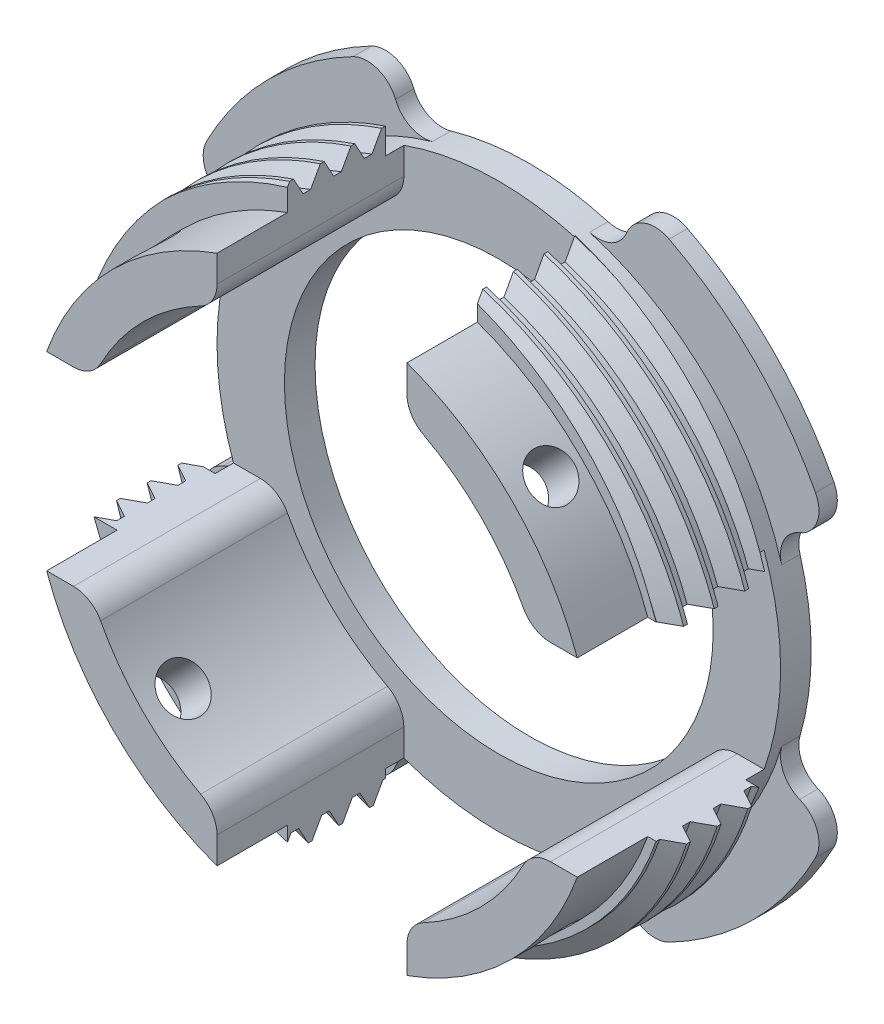
from build123d import *
from build123d.topology import SkipClean

# Parameters (mm, degrees)
SKETCH1_R                = 4.6
SKETCH1_R_2              = 3.9
BOSS_EXTRUDE1_DEPTH      = 0.5
BOSS_EXTRUDE2_DEPTH      = 3.05
FILLET_START             = 0.5
FILLET_1_DEPTH           = 3.05
EXTRUDE_1_DEPTH          = 2.4
THREAD_1_PITCH           = 0.5
PATTERN_CIRCULAR_1_COUNT = 4
SKETCH_9_R               = 3.9
SKETCH_9_R_2             = 3.5
EXTRUDE_2_DEPTH          = 0.5
SKETCH_11_OUTSIDE_W      = 14.29
SKETCH_11_OUTSIDE_H      = 14.29
SKETCH_11_OUTSIDE_R      = 4.6
CUT_EXTRUDE_1_DEPTH      = 0.8
EXTRUDE_4_DEPTH          = 0.3
FILLET_3_R               = 0.5
FILLET_4_DEPTH           = 0.3


with BuildPart() as part:
    # Sketch1 → Boss-Extrude1 (new body)
    with BuildSketch(Plane.XY):
        Circle(SKETCH1_R)
        Circle(SKETCH1_R_2, mode=Mode.SUBTRACT)
    extrude(amount=BOSS_EXTRUDE1_DEPTH)

    # Sketch2 → Boss-Extrude2 (add)
    with SkipClean():  # the faces are left unmerged after this step: merging them gives an invalid solid
        with BuildSketch(Plane.XY.offset(0.5)):
            with BuildLine():
                Line((4.330992958, 1.55), (3.578756767, 1.55))
                ThreePointArc((3.578756767, 1.55), (2.757716447, 2.757716447), (1.55, 3.578756767))
                Line((1.55, 3.578756767), (1.55, 4.330992958))
                ThreePointArc((1.55, 4.330992958), (3.252691193, 3.252691193), (4.330992958, 1.55))
            make_face()
            with BuildLine():
                Line((-4.330992958, 1.55), (-3.578756767, 1.55))
                ThreePointArc((-3.578756767, 1.55), (-2.757716447, 2.757716447), (-1.55, 3.578756767))
                Line((-1.55, 3.578756767), (-1.55, 4.330992958))
                ThreePointArc((-1.55, 4.330992958), (-3.252691193, 3.252691193), (-4.330992958, 1.55))
            make_face()
            with BuildLine():
                Line((1.55, -4.330992958), (1.55, -3.578756767))
                ThreePointArc((1.55, -3.578756767), (2.757716447, -2.757716447), (3.578756767, -1.55))
                Line((3.578756767, -1.55), (4.330992958, -1.55))
                ThreePointArc((4.330992958, -1.55), (3.252691193, -3.252691193), (1.55, -4.330992958))
            make_face()
            with BuildLine():
                Line((-4.330992958, -1.55), (-3.578756767, -1.55))
                ThreePointArc((-3.578756767, -1.55), (-2.757716447, -2.757716447), (-1.55, -3.578756767))
                Line((-1.55, -3.578756767), (-1.55, -4.330992958))
                ThreePointArc((-1.55, -4.330992958), (-3.252691193, -3.252691193), (-4.330992958, -1.55))
            make_face()
        extrude(amount=BOSS_EXTRUDE2_DEPTH)

    # 草图5 → M1x0.25 螺纹孔1 (revolve, cut)
    with SkipClean():  # the faces are left unmerged after this step: merging them gives an invalid solid
        with BuildSketch(Plane(origin=(3.252691193, 3.252691193, 2.9), x_dir=(-0.7071067811865452, 0.7071067811865499, 0), z_dir=(0, 0, 1))):
            Polygon((0, 0), (0, 3.475322732), (0.375, 3.25), (0.375, 0), align=None)
        m1x0_25_1 = revolve(axis=Axis((7.742819254, 7.742819254, 2.9), (-0.7071067811865499, -0.7071067811865452, 0)), mode=Mode.SUBTRACT)

    # 圆角1: read off the stored shape, not the designer's step
    # 圆角1 outline → 圆角1 (cut)
    with SkipClean():  # the faces are left unmerged after this step: merging them gives an invalid solid
        with BuildSketch(Plane.XY.offset(FILLET_START)):
            with BuildLine():
                Line((3.578756767, 1.55), (3.893263413, 1.55))
                ThreePointArc((3.893263413, 1.55), (3.634881208, 1.621936177), (3.450847116, 1.817045455))
                ThreePointArc((3.450847116, 1.817045455), (3.517337204, 1.68473707), (3.578756767, 1.55))
            make_face()
            with BuildLine():
                ThreePointArc((1.55, 3.578756767), (1.68473707, 3.517337204), (1.817045455, 3.450847116))
                ThreePointArc((1.817045455, 3.450847116), (1.621936177, 3.634881208), (1.55, 3.893263413))
                Line((1.55, 3.893263413), (1.55, 3.578756767))
            make_face()
            with BuildLine():
                Line((3.893263413, -1.55), (3.578756767, -1.55))
                ThreePointArc((3.578756767, -1.55), (3.517337204, -1.68473707), (3.450847116, -1.817045455))
                ThreePointArc((3.450847116, -1.817045455), (3.634881208, -1.621936177), (3.893263413, -1.55))
            make_face()
            with BuildLine():
                ThreePointArc((-1.817045455, 3.450847116), (-1.68473707, 3.517337204), (-1.55, 3.578756767))
                Line((-1.55, 3.578756767), (-1.55, 3.893263413))
                ThreePointArc((-1.55, 3.893263413), (-1.621936177, 3.634881208), (-1.817045455, 3.450847116))
            make_face()
            with BuildLine():
                Line((1.55, -3.578756767), (1.55, -3.893263413))
                ThreePointArc((1.55, -3.893263413), (1.621936177, -3.634881208), (1.817045455, -3.450847116))
                ThreePointArc((1.817045455, -3.450847116), (1.68473707, -3.517337204), (1.55, -3.578756767))
            make_face()
            with BuildLine():
                ThreePointArc((-3.450847116, 1.817045455), (-3.634881208, 1.621936177), (-3.893263413, 1.55))
                Line((-3.893263413, 1.55), (-3.578756767, 1.55))
                ThreePointArc((-3.578756767, 1.55), (-3.517337204, 1.68473707), (-3.450847116, 1.817045455))
            make_face()
            with BuildLine():
                ThreePointArc((-1.817045455, -3.450847116), (-1.621936177, -3.634881208), (-1.55, -3.893263413))
                Line((-1.55, -3.893263413), (-1.55, -3.578756767))
                ThreePointArc((-1.55, -3.578756767), (-1.68473707, -3.517337204), (-1.817045455, -3.450847116))
            make_face()
            with BuildLine():
                Line((-3.578756767, -1.55), (-3.893263413, -1.55))
                ThreePointArc((-3.893263413, -1.55), (-3.634881208, -1.621936177), (-3.450847116, -1.817045455))
                ThreePointArc((-3.450847116, -1.817045455), (-3.517337204, -1.68473707), (-3.578756767, -1.55))
            make_face()
        extrude(amount=FILLET_1_DEPTH, mode=Mode.SUBTRACT)

    # Sketch 1 → 凸台-拉伸1 (add)
    with BuildSketch(Plane.XY):
        with BuildLine():
            Line((-1.55, -4.010922587), (-1.55, -4.753682783))
            ThreePointArc((-1.55, -4.753682783), (-3.535533906, -3.535533906), (-4.753682783, -1.55))
            Line((-4.753682783, -1.55), (-4.010922587, -1.55))
            ThreePointArc((-4.010922587, -1.55), (-3.040559159, -3.040559159), (-1.55, -4.010922587))
        make_face()
        with BuildLine():
            Line((1.55, -4.010922587), (1.55, -4.753682783))
            ThreePointArc((1.55, -4.753682783), (3.535533906, -3.535533906), (4.753682783, -1.55))
            Line((4.753682783, -1.55), (4.010922587, -1.55))
            ThreePointArc((4.010922587, -1.55), (3.040559159, -3.040559159), (1.55, -4.010922587))
        make_face()
        with BuildLine():
            Line((-4.010922587, 1.55), (-4.753682783, 1.55))
            ThreePointArc((-4.753682783, 1.55), (-3.535533906, 3.535533906), (-1.55, 4.753682783))
            Line((-1.55, 4.753682783), (-1.55, 4.010922587))
            ThreePointArc((-1.55, 4.010922587), (-3.040559159, 3.040559159), (-4.010922587, 1.55))
        make_face()
        with BuildLine():
            Line((1.55, 4.010922587), (1.55, 4.753682783))
            ThreePointArc((1.55, 4.753682783), (3.535533906, 3.535533906), (4.753682783, 1.55))
            Line((4.753682783, 1.55), (4.010922587, 1.55))
            ThreePointArc((4.010922587, 1.55), (3.040559159, 3.040559159), (1.55, 4.010922587))
        make_face()
    extrude(amount=EXTRUDE_1_DEPTH)

    # 螺纹线1: arcs per turn and ends read off the stored shape
    # 螺纹线1: the profile of Sketch 1 2 profile screwed along a right-hand helix through 6.8 turns, 6 arcs to a turn; built about Z, then put on its axis
    thread_1_z = Axis((0, 0, 0), (0, 0, 1))
    thread_1_corners = [(5.0003, 0, -0.000173205), (5.0003, 0, 0.437673204), (4.729367062, 0, 0.281249999), (4.729367062, 0, 0.156249999)]
    with BuildLine(mode=Mode.PRIVATE) as thread_1_profile:
        Line(thread_1_corners[0], thread_1_corners[1])
        Line(thread_1_corners[1], thread_1_corners[2])
        Line(thread_1_corners[2], thread_1_corners[3])
        Line(thread_1_corners[3], thread_1_corners[0])
    thread_1_cap = Face(thread_1_profile.wire())
    thread_1_turn_angles = [0, 30, 60, 90, 120, 150, 180, 210, 240, 270, 300, 330, 360]
    thread_1_turn_weights = [1, 0.8660254037844387, 1, 0.8660254037844387, 1, 0.8660254037844387, 1, 0.8660254037844387, 1, 0.8660254037844387, 1, 0.8660254037844387, 1]
    thread_1_turn_rails = [Edge.make_bspline([Vector(p[0], p[1], 0).rotate(thread_1_z, thread_1_turn_angles[k]) / thread_1_turn_weights[k] + Vector(0, 0, p[2] + THREAD_1_PITCH * thread_1_turn_angles[k] / 360) for k in range(13)], [0, 0, 0, 1, 1, 2, 2, 3, 3, 4, 4, 5, 5, 6, 6, 6], 2, thread_1_turn_weights) for p in thread_1_corners]
    thread_1_turn_sides = [Face.make_surface_from_curves(thread_1_turn_rails[p[0]], thread_1_turn_rails[p[1]]) for p in [(0, 1), (1, 2), (2, 3), (3, 0)]]
    thread_1_last_angles = [2160, 2190, 2220, 2250, 2280, 2310, 2340, 2370, 2400, 2424, 2448]
    thread_1_last_weights = [1, 0.8660254037844387, 1, 0.8660254037844387, 1, 0.8660254037844387, 1, 0.8660254037844387, 1, 0.9135454576426009, 1]
    thread_1_last_rails = [Edge.make_bspline([Vector(p[0], p[1], 0).rotate(thread_1_z, thread_1_last_angles[k]) / thread_1_last_weights[k] + Vector(0, 0, p[2] + THREAD_1_PITCH * thread_1_last_angles[k] / 360) for k in range(11)], [0, 0, 0, 1, 1, 2, 2, 3, 3, 4, 4, 5, 5, 5], 2, thread_1_last_weights) for p in thread_1_corners]
    thread_1_last_sides = [Face.make_surface_from_curves(thread_1_last_rails[p[0]], thread_1_last_rails[p[1]]) for p in [(0, 1), (1, 2), (2, 3), (3, 0)]]
    thread_1 = Plane(origin=(0, 0, 3.4), x_dir=(-1, 0, 0), z_dir=(0, 0, -1)) * Solid(Shell([*[p.moved(Location((0, 0, THREAD_1_PITCH * i))) for i in range(6) for p in thread_1_turn_sides], *thread_1_last_sides, thread_1_cap, thread_1_cap.rotate(thread_1_z, 2448).moved(Location((0, 0, THREAD_1_PITCH * 2448 / 360)))]))
    add(thread_1, mode=Mode.SUBTRACT)

    # 阵列(圆周)1: M1x0.25 螺纹孔1 ×4 about axis
    pattern_circular_1_axis = Axis((0, 0, 0), (0, 0, 1))
    for i in range(1, PATTERN_CIRCULAR_1_COUNT):
        add(m1x0_25_1.rotate(pattern_circular_1_axis, i * 360 / PATTERN_CIRCULAR_1_COUNT), mode=Mode.SUBTRACT)

    # 草图9 → 凸台-拉伸2 (add)
    with BuildSketch(Plane(origin=(0, 0, 0), x_dir=(-1, 0, 0), z_dir=(0, 0, -1))):
        Circle(SKETCH_9_R)
        Circle(SKETCH_9_R_2, mode=Mode.SUBTRACT)
    extrude(amount=-EXTRUDE_2_DEPTH)

    # 草图11 outside → 切除-拉伸1 (cut)
    with SkipClean():  # the faces are left unmerged after this step: merging them gives an invalid solid
        with BuildSketch(Plane(origin=(0, 0, 0), x_dir=(-1, 0, 0), z_dir=(0, 0, -1))):
            Rectangle(SKETCH_11_OUTSIDE_W, SKETCH_11_OUTSIDE_H)
            with Locations(Location((0, 0, 0), (0, 0, 340.30844298))):
                Circle(SKETCH_11_OUTSIDE_R, mode=Mode.SUBTRACT)
        extrude(amount=-CUT_EXTRUDE_1_DEPTH, mode=Mode.SUBTRACT)
    add(part.part.scale(1), mode=Mode.REPLACE)  # the faces are merged on a copy

    # 草图12 → 凸台-拉伸4 (add)
    with SkipClean():  # the faces are left unmerged after this step: merging them gives an invalid solid
        with BuildSketch(Plane(origin=(0, 0, 0), x_dir=(-1, 0, 0), z_dir=(0, 0, -1))):
            with BuildLine():
                Line((-1.85, -4.211591148), (-1.85, -5.285593628))
                ThreePointArc((-1.85, -5.285593628), (-3.959797975, -3.959797975), (-5.285593628, -1.85))
                Line((-5.285593628, -1.85), (-4.211591148, -1.85))
                ThreePointArc((-4.211591148, -1.85), (-3.252691193, -3.252691193), (-1.85, -4.211591148))
            make_face()
            with BuildLine():
                Line((-4.211591148, 1.85), (-5.285593628, 1.85))
                ThreePointArc((-5.285593628, 1.85), (-3.959797975, 3.959797975), (-1.85, 5.285593628))
                Line((-1.85, 5.285593628), (-1.85, 4.211591148))
                ThreePointArc((-1.85, 4.211591148), (-3.252691193, 3.252691193), (-4.211591148, 1.85))
            make_face()
            with BuildLine():
                Line((1.85, 4.211591148), (1.85, 5.285593628))
                ThreePointArc((1.85, 5.285593628), (3.959797975, 3.959797975), (5.285593628, 1.85))
                Line((5.285593628, 1.85), (4.211591148, 1.85))
                ThreePointArc((4.211591148, 1.85), (3.252691193, 3.252691193), (1.85, 4.211591148))
            make_face()
            with BuildLine():
                Line((4.211591148, -1.85), (5.285593628, -1.85))
                ThreePointArc((5.285593628, -1.85), (3.959797975, -3.959797975), (1.85, -5.285593628))
                Line((1.85, -5.285593628), (1.85, -4.211591148))
                ThreePointArc((1.85, -4.211591148), (3.252691193, -3.252691193), (4.211591148, -1.85))
            make_face()
        extrude(amount=-EXTRUDE_4_DEPTH)

    # 圆角3
    fillet_3_edges = [part.edges().sort_by_distance(p)[0] for p in [
        (-5.285593628, -1.85, 0.15),
        (-1.85, -5.285593628, 0.15),
        (-1.85, 5.285593628, 0.15),
        (-5.285593628, 1.85, 0.15),
        (5.285593628, 1.85, 0.15),
        (1.85, 5.285593628, 0.15),
        (1.85, -5.285593628, 0.15),
        (5.285593628, -1.85, 0.15),
    ]]
    fillet(fillet_3_edges, radius=FILLET_3_R)

    # 圆角4: read off the stored shape, not the designer's step
    # 圆角4 outline → 圆角4 (add)
    with BuildSketch(Plane.XY):
        with BuildLine():
            ThreePointArc((4.712088722, -1.88579423), (4.448474871, -1.640787188), (4.417682589, -1.282217043))
            ThreePointArc((4.417682589, -1.282217043), (4.323966429, -1.569494926), (4.211591148, -1.85))
            Line((4.211591148, -1.85), (4.526311965, -1.85))
            ThreePointArc((4.526311965, -1.85), (4.620908781, -1.8590301), (4.712088722, -1.88579423))
        make_face()
        with BuildLine():
            Line((1.85, -4.526311965), (1.85, -4.211591148))
            ThreePointArc((1.85, -4.211591148), (1.569494926, -4.323966429), (1.282217043, -4.417682589))
            ThreePointArc((1.282217043, -4.417682589), (1.640787188, -4.448474871), (1.88579423, -4.712088722))
            ThreePointArc((1.88579423, -4.712088722), (1.8590301, -4.620908781), (1.85, -4.526311965))
        make_face()
        with BuildLine():
            ThreePointArc((4.211591148, 1.85), (4.323966429, 1.569494926), (4.417682589, 1.282217043))
            ThreePointArc((4.417682589, 1.282217043), (4.448474871, 1.640787188), (4.712088722, 1.88579423))
            ThreePointArc((4.712088722, 1.88579423), (4.620908781, 1.8590301), (4.526311965, 1.85))
            Line((4.526311965, 1.85), (4.211591148, 1.85))
        make_face()
        with BuildLine():
            ThreePointArc((-1.88579423, -4.712088722), (-1.640787188, -4.448474871), (-1.282217043, -4.417682589))
            ThreePointArc((-1.282217043, -4.417682589), (-1.569494926, -4.323966429), (-1.85, -4.211591148))
            Line((-1.85, -4.211591148), (-1.85, -4.526311965))
            ThreePointArc((-1.85, -4.526311965), (-1.8590301, -4.620908781), (-1.88579423, -4.712088722))
        make_face()
        with BuildLine():
            ThreePointArc((1.282217043, 4.417682589), (1.569494926, 4.323966429), (1.85, 4.211591148))
            Line((1.85, 4.211591148), (1.85, 4.526311965))
            ThreePointArc((1.85, 4.526311965), (1.8590301, 4.620908781), (1.88579423, 4.712088722))
            ThreePointArc((1.88579423, 4.712088722), (1.640787188, 4.448474871), (1.282217043, 4.417682589))
        make_face()
        with BuildLine():
            Line((-4.526311965, -1.85), (-4.211591148, -1.85))
            ThreePointArc((-4.211591148, -1.85), (-4.323966429, -1.569494926), (-4.417682589, -1.282217043))
            ThreePointArc((-4.417682589, -1.282217043), (-4.448474871, -1.640787188), (-4.712088722, -1.88579423))
            ThreePointArc((-4.712088722, -1.88579423), (-4.620908781, -1.8590301), (-4.526311965, -1.85))
        make_face()
        with BuildLine():
            ThreePointArc((-1.85, 4.211591148), (-1.569494926, 4.323966429), (-1.282217043, 4.417682589))
            ThreePointArc((-1.282217043, 4.417682589), (-1.640787188, 4.448474871), (-1.88579423, 4.712088722))
            ThreePointArc((-1.88579423, 4.712088722), (-1.8590301, 4.620908781), (-1.85, 4.526311965))
            Line((-1.85, 4.526311965), (-1.85, 4.211591148))
        make_face()
        with BuildLine():
            ThreePointArc((-4.712088722, 1.88579423), (-4.448474871, 1.640787188), (-4.417682589, 1.282217043))
            ThreePointArc((-4.417682589, 1.282217043), (-4.323966429, 1.569494926), (-4.211591148, 1.85))
            Line((-4.211591148, 1.85), (-4.526311965, 1.85))
            ThreePointArc((-4.526311965, 1.85), (-4.620908781, 1.8590301), (-4.712088722, 1.88579423))
        make_face()
    extrude(amount=FILLET_4_DEPTH)


solid = part.part
